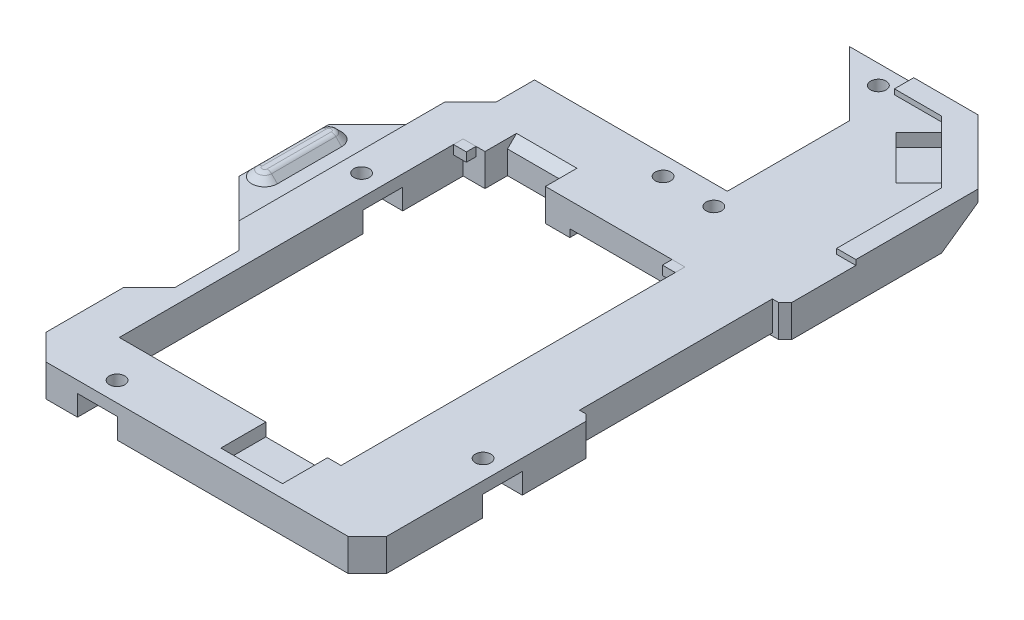
from build123d import *

# Parameters (mm, degrees)
EXTRUDE_1_DEPTH      = 5
CUT_EXTRUDE_1_DEPTH  = 5
CHAMFER_1_SIZE       = 1.4
SKETCH_3_W           = 2
SKETCH_3_H           = 1.5
EXTRUDE_2_DEPTH      = 1.4
EXTRUDE_2_2_DEPTH    = 1.4
CHAMFER_2_SIZE       = 4
EXTRUDE_4_DEPTH      = 2
EXTRUDE_5_DEPTH      = 3
CHAMFER_4_SIZE       = 3
EXTRUDE_6_DEPTH      = 5
CHAMFER_5_SIZE       = 4
SKETCH_9_R           = 2.05
CUT_EXTRUDE_2_DEPTH  = 2
SKETCH_10_R          = 1.2
CUT_EXTRUDE_3_DEPTH  = 3
CHAMFER_6_SIZE       = 1
CHAMFER_7_SIZE       = 3
SKETCH_11_W          = 2
SKETCH_11_H          = 30
CUT_EXTRUDE_4_DEPTH  = 117.404467268
SKETCH_12_W          = 6
SKETCH_12_H          = 6.2
SKETCH_12_W_2        = 6.2
SKETCH_12_H_2        = 6.1
SKETCH_12_W_3        = 6.4
CUT_EXTRUDE_5_DEPTH  = 3.2
SKETCH_12_4_R        = 1.2
CUT_EXTRUDE_6_DEPTH  = 117.404467268
SKETCH_13_W          = 9.6
SKETCH_13_H          = 7
CUT_EXTRUDE_7_DEPTH  = 2
SKETCH_14_W          = 10
SKETCH_14_H          = 3
CUT_EXTRUDE_8_DEPTH  = 3
CHAMFER_8_SIZE       = 3
EXTRUDE_7_DEPTH      = 15
CHAMFER_9_SIZE       = 1
SKETCH_16_W          = 15
SKETCH_16_H          = 5.4
CUT_EXTRUDE_9_DEPTH  = 1.2
EXTRUDE_8_DEPTH      = 1.2
CHAMFER_10_SIZE      = 1.2
FILLET_START         = -55.913222165
FILLET_1_DEPTH       = 11.82644433
FILLET_1_2_ANGLE     = 180
FILLET_1_3_ANGLE     = 180
SKETCH_18_R          = 1.2
CUT_EXTRUDE_10_DEPTH = 117.404467268
SKETCH_18_3_R        = 2.05
CUT_EXTRUDE_11_DEPTH = 2
EXTRUDE_3_DEPTH      = 0.8
CUT_EXTRUDE_12_DEPTH = 2
CHAMFER_11_SIZE      = 0.4


with BuildPart() as part:
    # 草图1 → 凸台-拉伸1 (new body)
    with BuildSketch(Plane(origin=(0, 0, 0), x_dir=(1, 0, 0), z_dir=(0, 1, 0))):
        Polygon((40, 105), (50, 95), (50, 0), (0, 0), (0, 76), (30, 76), (30, 95), (20, 105), align=None)
    extrude(amount=EXTRUDE_1_DEPTH)

    # 草图2 → 切除-拉伸1 (cut)
    with BuildSketch(Plane.XZ):
        Polygon((15.2, -62.5), (36.9, -62.5), (36.9, -9), (2.4, -9), (2.4, -62.5), (5.8, -62.5), (5.8, -66), (15.2, -66), align=None)
    extrude(amount=-CUT_EXTRUDE_1_DEPTH, mode=Mode.SUBTRACT)

    # 倒角1
    chamfer_1_edges = [part.edges().sort_by_distance(p)[0] for p in [
        (10.5, 5, -66),
    ]]
    chamfer(chamfer_1_edges, length=CHAMFER_1_SIZE)

    # 倒角2
    chamfer_2_edges = [part.edges().sort_by_distance(p)[0] for p in [
        (45, 0, -100),
    ]]
    chamfer(chamfer_2_edges, length=CHAMFER_2_SIZE)

    # 草图6 → 凸台-拉伸4 (add)
    with BuildSketch(Plane.XZ):
        Polygon((0, -70), (0, -30), (-13, -43), (-13, -57), align=None)
    extrude(amount=-EXTRUDE_4_DEPTH)

    # 草图7 → 凸台-拉伸5 (add)
    with BuildSketch(Plane(origin=(0, 2, 0), x_dir=(1, 0, 0), z_dir=(0, 1, 0))):
        Polygon((-4, 66), (-4, 34), (0, 30), (0, 70), align=None)
    extrude(amount=EXTRUDE_5_DEPTH)

    # 倒角4
    chamfer_4_edges = [part.edges().sort_by_distance(p)[0] for p in [
        (-4, 2, -50),
    ]]
    chamfer(chamfer_4_edges, length=CHAMFER_4_SIZE - 0.0001)  # a hair under: the kernel refuses the full size

    # 草图8 → 凸台-拉伸6 (add)
    with BuildSketch(Plane.XZ):
        Polygon((0, -20), (0, 0), (-4, -4), (-4, -16), align=None)
    extrude(amount=-EXTRUDE_6_DEPTH)

    # 倒角5
    chamfer_5_edges = [part.edges().sort_by_distance(p)[0] for p in [
        (-4, 0, -10),
    ]]
    chamfer(chamfer_5_edges, length=CHAMFER_5_SIZE)

    # 草图9 → 切除-拉伸2 (cut)
    with BuildSketch(Plane.XZ):
        with Locations(Location((27.5, -102, 0), (0, 0, 270))):
            Circle(SKETCH_9_R)
    extrude(amount=-CUT_EXTRUDE_2_DEPTH, mode=Mode.SUBTRACT)

    # 草图10 → 切除-拉伸3 (cut)
    with BuildSketch(Plane.XZ.offset(-2)):
        with Locations(Location((27.5, -102, 0), (0, 0, 270))):
            Circle(SKETCH_10_R)
    extrude(amount=-CUT_EXTRUDE_3_DEPTH, mode=Mode.SUBTRACT)

    # 倒角6
    chamfer_6_edges = [part.edges().sort_by_distance(p)[0] for p in [
        (-6.5, 0, -36.5),
        (-13, 0, -50),
        (-6.5, 0, -63.5),
    ]]
    chamfer(chamfer_6_edges, length=CHAMFER_6_SIZE)

    # 倒角7
    chamfer_7_edges = [part.edges().sort_by_distance(p)[0] for p in [
        (50, 2.5, 0),
    ]]
    chamfer(chamfer_7_edges, length=CHAMFER_7_SIZE)

    # 草图11 → 切除-拉伸4 (cut, through all)
    with BuildSketch(Plane(origin=(0, 5, 0), x_dir=(1, 0, 0), z_dir=(0, 1, 0))):
        with Locations((49, 50)):
            Rectangle(SKETCH_11_W, SKETCH_11_H)
    extrude(amount=-CUT_EXTRUDE_4_DEPTH, mode=Mode.SUBTRACT)

    # 草图12 → 切除-拉伸5 (cut)
    with BuildSketch(Plane.XZ):
        with Locations((47, -21)):
            Rectangle(SKETCH_12_W, SKETCH_12_H)
        with Locations((8, -3.05)):
            Rectangle(SKETCH_12_W_2, SKETCH_12_H_2)
        Polygon((27.9, -76), (27.9, -69.8), (34.1, -69.8), (34.1, -76), (30, -76), align=None)
        with Locations((-0.8, -50)):
            Rectangle(SKETCH_12_W_3, SKETCH_12_H)
    extrude(amount=-CUT_EXTRUDE_5_DEPTH, mode=Mode.SUBTRACT)

    # 草图12<4> → 切除-拉伸6 (cut, through all)
    with BuildSketch(Plane.XZ):
        with Locations(Location((8, -3.05, 0), (0, 0, 270))):
            Circle(SKETCH_12_4_R)
        with Locations(Location((47, -21, 0), (0, 0, 270))):
            Circle(SKETCH_12_4_R)
        with Locations(Location((31, -72.9, 0), (0, 0, 270))):
            Circle(SKETCH_12_4_R)
        with Locations(Location((-0.9, -50, 0), (0, 0, 270))):
            Circle(SKETCH_12_4_R)
    extrude(amount=-CUT_EXTRUDE_6_DEPTH, mode=Mode.SUBTRACT)

    # 草图13 → 切除-拉伸7 (cut)
    with BuildSketch(Plane(origin=(0, 5, 0), x_dir=(1, 0, 0), z_dir=(0, 1, 0))):
        with Locations((30.000080746, 5.5)):
            Rectangle(SKETCH_13_W, SKETCH_13_H)
    extrude(amount=-CUT_EXTRUDE_7_DEPTH, mode=Mode.SUBTRACT)

    # 草图14 → 切除-拉伸8 (cut)
    with BuildSketch(Plane.XZ):
        with Locations((19.6, -7.5)):
            Rectangle(SKETCH_14_W, SKETCH_14_H)
    extrude(amount=-CUT_EXTRUDE_8_DEPTH, mode=Mode.SUBTRACT)

    # 倒角8
    chamfer_8_edges = [part.edges().sort_by_distance(p)[0] for p in [
        (19.6, 3, -6),
    ]]
    chamfer(chamfer_8_edges, length=CHAMFER_8_SIZE - 0.0001)  # a hair under: the kernel refuses the full size

    # 草图15 → 凸台-拉伸7 (add)
    with BuildSketch(Plane.ZY):
        Polygon((-76, 5), (-76, 0), (-80, 0), (-80, 1), align=None)
    extrude(amount=-EXTRUDE_7_DEPTH)

    # 倒角9
    chamfer_9_edges = [part.edges().sort_by_distance(p)[0] for p in [
        (50, 2.5, -65),
        (50, 2.5, -35),
    ]]
    chamfer(chamfer_9_edges, length=CHAMFER_9_SIZE)

    # 草图16 → 切除-拉伸9 (cut)
    with BuildSketch(Plane.XZ):
        with Locations((26.5, -65.2)):
            Rectangle(SKETCH_16_W, SKETCH_16_H)
    extrude(amount=-CUT_EXTRUDE_9_DEPTH, mode=Mode.SUBTRACT)

    # 草图17 → 凸台-拉伸8 (add)
    with BuildSketch(Plane(origin=(0, 2, 0), x_dir=(1, 0, 0), z_dir=(0, 1, 0))):
        with BuildLine():
            Line((-10.2, 55), (-10.2, 45))
            ThreePointArc((-10.2, 45), (-11, 44.2), (-11.8, 45))
            Line((-11.8, 45), (-11.8, 55))
            ThreePointArc((-11.8, 55), (-11, 55.8), (-10.2, 55))
        make_face()
    extrude(amount=EXTRUDE_8_DEPTH)

    # 倒角10
    chamfer_10_edges = [part.edges().sort_by_distance(p)[0] for p in [
        (-10.2, 2, -50),
        (-11, 2, -55.8),
        (-11, 2, -44.2),
        (-11.8, 2, -50),
    ]]
    chamfer(chamfer_10_edges, length=CHAMFER_10_SIZE - 0.0001)  # a hair under: the kernel refuses the full size

    # 圆角1: read off the stored shape, not the designer's step
    # 圆角1 outline → 圆角1 (cut)
    with BuildSketch(Plane.XY.offset(FILLET_START)):
        with BuildLine():
            Line((-10.2, 3.2), (-10.614213562, 3.2))
            ThreePointArc((-10.614213562, 3.2), (-10.23153013, 3.123879533), (-9.907106781, 2.907106781))
            Line((-9.907106781, 2.907106781), (-10.2, 3.2))
        make_face()
        with BuildLine():
            ThreePointArc((-12.092893219, 2.907106781), (-11.76846987, 3.123879533), (-11.385786438, 3.2))
            Line((-11.385786438, 3.2), (-11.8, 3.2))
            Line((-11.8, 3.2), (-12.092893219, 2.907106781))
        make_face()
    extrude(amount=FILLET_1_DEPTH, mode=Mode.SUBTRACT)

    # Fillet 1 2 outline → Fillet 1 2 (revolve, cut)
    with BuildSketch(Plane(origin=(-11, 0, -45), x_dir=(-1, 0, 0), z_dir=(0, 0, -1))):
        with BuildLine():
            ThreePointArc((0.385786438, 3.2), (0.76846987, 3.123879533), (1.092893219, 2.907106781))
            Line((1.092893219, 2.907106781), (1.092893219, 3.2))
            Line((1.092893219, 3.2), (0.385786438, 3.2))
        make_face()
    revolve(axis=Axis((-11, 0, -45), (0, 1, 0)), revolution_arc=FILLET_1_2_ANGLE, mode=Mode.SUBTRACT)

    # Fillet 1 3 outline → Fillet 1 3 (revolve, cut)
    with BuildSketch(Plane(origin=(-11, 0, -55), x_dir=(1, 0, 0), z_dir=(0, 0, 1))):
        with BuildLine():
            ThreePointArc((0.385786438, 3.2), (0.76846987, 3.123879533), (1.092893219, 2.907106781))
            Line((1.092893219, 2.907106781), (1.092893219, 3.2))
            Line((1.092893219, 3.2), (0.385786438, 3.2))
        make_face()
    revolve(axis=Axis((-11, 0, -55), (0, 1, 0)), revolution_arc=FILLET_1_3_ANGLE, mode=Mode.SUBTRACT)

    # 草图18 → 切除-拉伸10 (cut, through all)
    with BuildSketch(Plane.XZ):
        with Locations(Location((23, -73, 0), (0, 0, 270))):
            Circle(SKETCH_18_R)
    extrude(amount=-CUT_EXTRUDE_10_DEPTH, mode=Mode.SUBTRACT)

    # 草图18<3> → 切除-拉伸11 (cut)
    with BuildSketch(Plane.XZ):
        with Locations(Location((23, -73, 0), (0, 0, 270))):
            Circle(SKETCH_18_3_R)
    extrude(amount=-CUT_EXTRUDE_11_DEPTH, mode=Mode.SUBTRACT)

    # 草图5 → 凸台-拉伸3 (add)
    with BuildSketch(Plane(origin=(0, 5, 0), x_dir=(1, 0, 0), z_dir=(0, 1, 0))):
        Polygon((40, 105), (30, 105), (30, 104.8), (30, 102), (37.343145751, 102), (47, 92.343145751), (47, 76), (50, 76), (50, 95), align=None)
    extrude(amount=EXTRUDE_3_DEPTH)

    # 草图19 → 切除-拉伸12 (cut)
    with BuildSketch(Plane(origin=(0, 5, 0), x_dir=(1, 0, 0), z_dir=(0, 1, 0))):
        Polygon((38.757359313, 100.585786438), (45.585786438, 93.757359313), (42.050252532, 90.221825407), (35.221825407, 97.050252532), align=None)
    extrude(amount=-CUT_EXTRUDE_12_DEPTH, mode=Mode.SUBTRACT)

    # 倒角11
    chamfer_11_edges = [part.edges().sort_by_distance(p)[0] for p in [
        (48, 0, -50),
    ]]
    chamfer(chamfer_11_edges, length=CHAMFER_11_SIZE)


with BuildPart() as body_2:
    # 草图3 → 凸台-拉伸2 (new body)
    with BuildSketch(Plane(origin=(0, 5, 0), x_dir=(1, 0, 0), z_dir=(0, 1, 0))):
        with Locations((3.4, 61.75)):
            Rectangle(SKETCH_3_W, SKETCH_3_H)
    extrude(amount=-EXTRUDE_2_DEPTH)


with BuildPart() as body_3:
    # 草图3 → Extrude 2 2 (new body)
    with BuildSketch(Plane(origin=(0, 5, 0), x_dir=(1, 0, 0), z_dir=(0, 1, 0))):
        with Locations((35.9, 61.75)):
            Rectangle(SKETCH_3_W, SKETCH_3_H)
    extrude(amount=-EXTRUDE_2_2_DEPTH)


solid = Compound([part.part, body_2.part, body_3.part])
